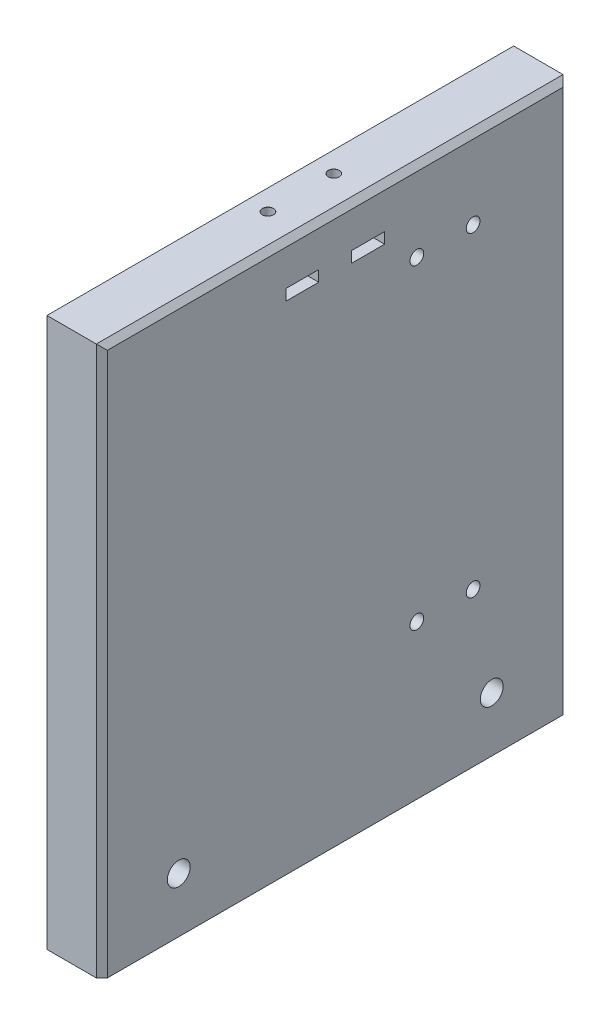
from build123d import *

# Parameters (mm, degrees)
SKETCH1_W                       = 200
SKETCH1_H                       = 100
BOSS_EXTRUDE1_DEPTH             = 10
SKETCH3_W                       = 20
SKETCH3_H                       = 170
BOSS_EXTRUDE2_DEPTH             = 200
CHAMFER1_SIZE                   = 2
F_4_0MM_DOWEL_HOLE1_D           = 4
F_4_0MM_DOWEL_HOLE1_DEPTH       = 20
F_4_0MM_DOWEL_HOLE1_CSINK_D     = 4.05
F_4_0MM_DOWEL_HOLE1_CSINK_ANGLE = 90
F_4_0MM_DOWEL_HOLE1_TIP         = 1.201721238
CUT_EXTRUDE11_DEPTH             = 225.499443206
CUT_EXTRUDE11_DEPTH_BACK        = 225.499443206
SKETCH27_R                      = 4.165
SKETCH27_R_2                    = 2.5
SKETCH29_W                      = 12
SKETCH29_H                      = 4
CUT_EXTRUDE13_DEPTH             = 225.499443206


with BuildPart() as part:
    # Sketch1 → Boss-Extrude1 (new body)
    with BuildSketch(Plane(origin=(0, 0, 0), x_dir=(1, 0, 0), z_dir=(0, 1, 0))):
        with Locations((100, 50)):
            Rectangle(SKETCH1_W, SKETCH1_H)
    extrude(amount=BOSS_EXTRUDE1_DEPTH)


with BuildPart() as body_2:
    # Sketch3 → Boss-Extrude2 (new body)
    with BuildSketch(Plane(origin=(0, 0, 0), x_dir=(-1, 0, 0), z_dir=(0, 1, 0))):
        with Locations((190, -15)):
            Rectangle(SKETCH3_W, SKETCH3_H)
    extrude(amount=BOSS_EXTRUDE2_DEPTH)

    # Chamfer1
    chamfer1_edges = [body_2.edges().sort_by_distance(p)[0] for p in [
        (-180, 100, -100),
        (-180, 200, -15),
        (-180, 100, 70),
    ]]
    chamfer(chamfer1_edges, length=CHAMFER1_SIZE)

    # Ø4.0mm Dowel Hole1
    with Locations(Plane(origin=(0, 200, 0), x_dir=(1, 0, 0), z_dir=(0, 1, 0))):
        with Locations((-192.5, 27), (-192.5, 3)):
            CounterSinkHole(F_4_0MM_DOWEL_HOLE1_D / 2, F_4_0MM_DOWEL_HOLE1_CSINK_D / 2, depth=F_4_0MM_DOWEL_HOLE1_DEPTH, counter_sink_angle=F_4_0MM_DOWEL_HOLE1_CSINK_ANGLE)
            with Locations((0, 0, -(F_4_0MM_DOWEL_HOLE1_DEPTH + F_4_0MM_DOWEL_HOLE1_TIP / 2))):  # 118° drill point
                Cone(0, F_4_0MM_DOWEL_HOLE1_D / 2, F_4_0MM_DOWEL_HOLE1_TIP, mode=Mode.SUBTRACT)

    # Sketch27 → Cut-Extrude11 (cut, two sides: drawn at the far end of the back side and taken through both)
    with BuildSketch(Plane(origin=(-180, 0, 0), x_dir=(0, 0, -1), z_dir=(1, 0, 0)).offset(-CUT_EXTRUDE11_DEPTH_BACK)):
        with Locations((-41.9914, 19.9898)):
            Circle(SKETCH27_R)
        with Locations((72.0168, 19.9898)):
            Circle(SKETCH27_R)
        with Locations((65.233902819, 171)):
            Circle(SKETCH27_R_2)
        with Locations((44.736876859, 171)):
            Circle(SKETCH27_R_2)
        with Locations((65.233902819, 56)):
            Circle(SKETCH27_R_2)
        with Locations((44.736876859, 56)):
            Circle(SKETCH27_R_2)
    extrude(amount=CUT_EXTRUDE11_DEPTH + CUT_EXTRUDE11_DEPTH_BACK, mode=Mode.SUBTRACT)

    # Sketch29 → Cut-Extrude13 (cut, through all)
    with BuildSketch(Plane(origin=(-180, 0, 0), x_dir=(0, 0, -1), z_dir=(1, 0, 0))):
        with Locations((3, 182.975)):
            Rectangle(SKETCH29_W, SKETCH29_H)
    cut_extrude13 = extrude(amount=-CUT_EXTRUDE13_DEPTH, mode=Mode.SUBTRACT)

    # Mirror16: Cut-Extrude13 across plane
    add(cut_extrude13.mirror(Plane.XY.offset(-15)), mode=Mode.SUBTRACT)


solid = body_2.part
